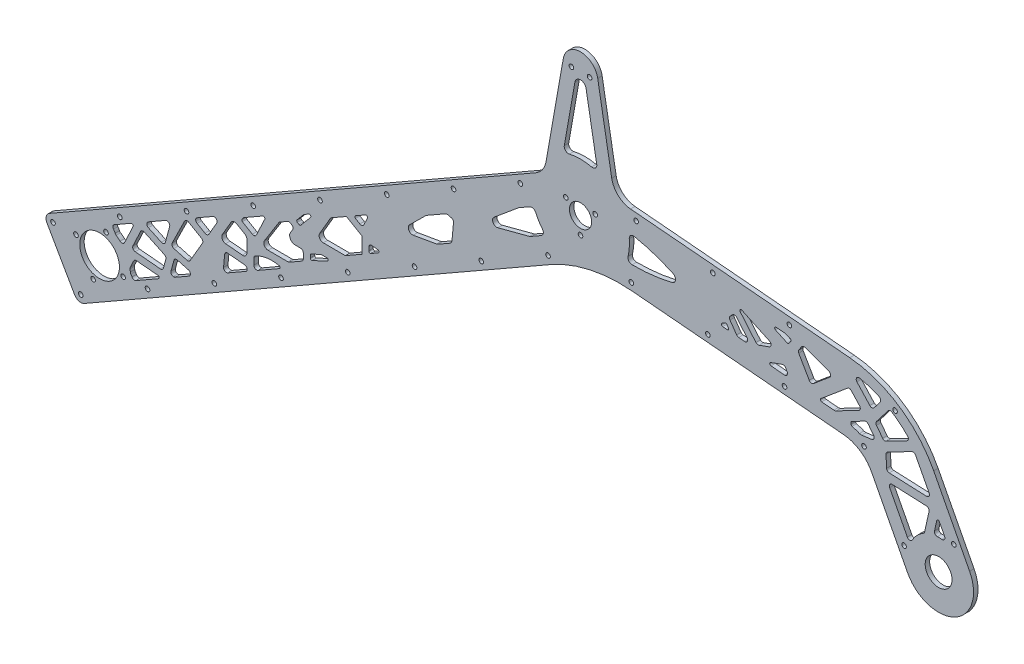
from build123d import *

# Parameters (mm, degrees)
SKETCH2_R              = 7.9375
SKETCH2_R_2            = 14.2
SKETCH2_R_3            = 1.65
SKETCH2_R_4            = 9.5885
BASE_DEPTH             = 3.175
SKETCH3_R              = 1.65
STRUT_HOLES_DEPTH      = 448.434897902
LIGHTENING_HOLES_DEPTH = 448.434897902
SKETCH7_R              = 1.65
CUT_EXTRUDE1_DEPTH     = 448.434897902


with BuildPart() as part:
    # Sketch2 → Base (new body)
    with BuildSketch(Plane.XY):
        with BuildLine():
            Line((-379.716809958, -188.506893436), (-32.006532147, 10.487277971))
            ThreePointArc((-32.006532147, 10.487277971), (-27.186230121, 14.879084252), (-24.685038782, 20.901319377))
            Line((-24.685038782, 20.901319377), (-12.310096913, 91.083102221))
            ThreePointArc((-12.310096913, 91.083102221), (0, 101.4125), (12.310096913, 91.083102221))
            Line((12.310096913, 91.083102221), (22.322003955, 34.302755831))
            ThreePointArc((22.322003955, 34.302755831), (26.960267136, 25.848318444), (35.786784109, 21.964558025))
            Line((35.786784109, 21.964558025), (192.586144941, 8.246391504))
            ThreePointArc((192.586144941, 8.246391504), (227.717231711, -4.10798993), (252.575276723, -31.83706486))
            Line((252.575276723, -31.83706486), (278.255270829, -81.167874559))
            ThreePointArc((278.255270829, -81.167874559), (267.623715331, -114.886860719), (233.904729171, -104.255305221))
            Line((233.904729171, -104.255305221), (208.224735064, -54.924495522))
            ThreePointArc((208.224735064, -54.924495522), (199.93872006, -45.681470545), (188.228357804, -41.563343401))
            Line((188.228357804, -41.563343401), (36.823729736, -28.317154839))
            ThreePointArc((36.823729736, -28.317154839), (6.649577682, -30.266109959), (-21.562664076, -41.144864173))
            Line((-21.562664076, -41.144864173), (-354.881400189, -231.902773674))
            ThreePointArc((-354.881400189, -231.902773674), (-358.677364619, -232.387866435), (-361.70452919, -230.046726627))
            Line((-361.70452919, -230.046726627), (-381.572857005, -195.330022437))
            ThreePointArc((-381.572857005, -195.330022437), (-382.057949767, -191.534058007), (-379.716809958, -188.506893436))
        make_face()
        Circle(SKETCH2_R, mode=Mode.SUBTRACT)
        with Locations((-343.92, -196.825)):
            Circle(SKETCH2_R_2, mode=Mode.SUBTRACT)
        with Locations((-6.5, 88.9125)):
            Circle(SKETCH2_R_3, mode=Mode.SUBTRACT)
        with Locations((6.5, 88.9125)):
            Circle(SKETCH2_R_3, mode=Mode.SUBTRACT)
        with Locations((256.08, -92.71158989)):
            Circle(SKETCH2_R_4, mode=Mode.SUBTRACT)
        with Locations((-360.806382749, -192.231517914)):
            Circle(SKETCH2_R_3, mode=Mode.SUBTRACT)
        with Locations((-339.326517914, -179.938617251)):
            Circle(SKETCH2_R_3, mode=Mode.SUBTRACT)
        with Locations((-327.033617251, -201.418482086)):
            Circle(SKETCH2_R_3, mode=Mode.SUBTRACT)
        with Locations((-348.513482086, -213.711382749)):
            Circle(SKETCH2_R_3, mode=Mode.SUBTRACT)
    extrude(amount=BASE_DEPTH)

    # Sketch3 → Strut Holes (cut, through all)
    with BuildSketch(Plane.XY.offset(3.175)):
        with Locations((-357.364941166, -227.56318565)):
            Circle(SKETCH3_R)
        with Locations((-309.629472905, -200.244234904)):
            Circle(SKETCH3_R)
        with Locations((-261.894004643, -172.925284158)):
            Circle(SKETCH3_R)
        with Locations((-214.158536382, -145.606333412)):
            Circle(SKETCH3_R)
        with Locations((-166.42306812, -118.287382666)):
            Circle(SKETCH3_R)
        with Locations((-118.687599859, -90.96843192)):
            Circle(SKETCH3_R)
        with Locations((-329.49780072, -165.527530714)):
            Circle(SKETCH3_R)
        with Locations((-377.233268981, -192.84648146)):
            Circle(SKETCH3_R)
        with Locations((-281.762332458, -138.208579968)):
            Circle(SKETCH3_R)
        with Locations((-234.026864197, -110.889629222)):
            Circle(SKETCH3_R)
        with Locations((-186.291395936, -83.570678476)):
            Circle(SKETCH3_R)
        with Locations((-138.555927674, -56.25172773)):
            Circle(SKETCH3_R)
        with Locations((36.307361546, -23.252879289)):
            Circle(SKETCH3_R)
        with Locations((91.098069941, -28.04644514)):
            Circle(SKETCH3_R)
        with Locations((145.888778336, -32.840010991)):
            Circle(SKETCH3_R)
        with Locations((149.375008046, 7.007776933)):
            Circle(SKETCH3_R)
        with Locations((94.584299651, 11.801342784)):
            Circle(SKETCH3_R)
        with Locations((39.793591256, 16.594908635)):
            Circle(SKETCH3_R)
        with Locations((-70.952131597, -63.649481174)):
            Circle(SKETCH3_R)
        with Locations((-23.216663336, -36.330530428)):
            Circle(SKETCH3_R)
        with Locations((-43.084991151, -1.613826238)):
            Circle(SKETCH3_R)
        with Locations((-90.820459413, -28.932776984)):
            Circle(SKETCH3_R)
        with Locations((202.716571226, -41.524122484)):
            Circle(SKETCH3_R)
        with Locations((224.939380546, -8.265337992)):
            Circle(SKETCH3_R)
        with Locations((231.413554138, -88.641399657)):
            Circle(SKETCH3_R)
        with Locations((266.893987465, -70.171455127)):
            Circle(SKETCH3_R)
    extrude(amount=-STRUT_HOLES_DEPTH, mode=Mode.SUBTRACT)

    # Sketch6 → Lightening Holes (cut, through all)
    with BuildSketch(Plane.XY.offset(3.175)):
        with BuildLine():
            Line((-317.937082153, -199.237754107), (-301.759255291, -189.979203363))
            ThreePointArc((-301.759255291, -189.979203363), (-301.27885272, -188.89855459), (-302.165025934, -188.115429161))
            Line((-302.165025934, -188.115429161), (-317.529091672, -186.71244549))
            ThreePointArc((-317.529091672, -186.71244549), (-318.704383169, -186.968323474), (-319.520360019, -187.852045956))
            Line((-319.520360019, -187.852045956), (-321.920665487, -192.94890269))
            ThreePointArc((-321.920665487, -192.94890269), (-322.086706026, -193.488507205), (-322.095332893, -194.053014132))
            ThreePointArc((-322.095332893, -194.053014132), (-321.995430567, -195.004765075), (-321.937013257, -195.959960211))
            ThreePointArc((-321.937013257, -195.959960211), (-321.816611469, -196.56901374), (-321.515239324, -197.111800643))
            ThreePointArc((-321.515239324, -197.111800643), (-321.089709213, -197.721191561), (-320.73119159, -198.372266273))
            ThreePointArc((-320.73119159, -198.372266273), (-319.522268091, -199.412366176), (-317.937082153, -199.237754107))
        make_face()
        with BuildLine():
            Line((-289.844978396, -183.160677107), (-279.93882887, -177.491399715))
            ThreePointArc((-279.93882887, -177.491399715), (-278.948378644, -175.502042811), (-280.407275879, -173.825692191))
            Line((-280.407275879, -173.825692191), (-288.292322007, -171.680779414))
            ThreePointArc((-288.292322007, -171.680779414), (-289.810707779, -171.874816518), (-290.747163702, -173.085682346))
            Line((-290.747163702, -173.085682346), (-292.868560549, -180.884280112))
            ThreePointArc((-292.868560549, -180.884280112), (-292.613471256, -182.502456625), (-291.234784363, -183.387209827))
            ThreePointArc((-291.234784363, -183.387209827), (-291.195764259, -183.393163574), (-291.156778347, -183.399337252))
            ThreePointArc((-291.156778347, -183.399337252), (-290.480404568, -183.392541824), (-289.844978396, -183.160677107))
        make_face()
        with BuildLine():
            Line((-225.068253149, -146.0890356), (-215.394271166, -140.552627413))
            ThreePointArc((-215.394271166, -140.552627413), (-214.903636001, -139.526112554), (-215.691072999, -138.704894803))
            ThreePointArc((-215.691072999, -138.704894803), (-224.321295756, -138.46558821), (-232.518295989, -141.176160044))
            ThreePointArc((-232.518295989, -141.176160044), (-233.286477009, -141.90836482), (-233.571916458, -142.930495063))
            Line((-233.571916458, -142.930495063), (-233.587977081, -147.160409637))
            Line((-233.587977081, -147.160409637), (-233.589300921, -147.509071621))
            ThreePointArc((-233.589300921, -147.509071621), (-232.59588453, -149.244906831), (-230.595898947, -149.252500605))
            Line((-230.595898947, -149.252500605), (-225.068253149, -146.0890356))
        make_face()
        with BuildLine():
            Line((-202.450189496, -105.529322903), (-201.311100417, -106.192755657))
            ThreePointArc((-201.311100417, -106.192755657), (-200.637908098, -106.314094916), (-200.044217491, -105.974326499))
            Line((-200.044217491, -105.974326499), (-193.10874934, -97.772404377))
            ThreePointArc((-193.10874934, -97.772404377), (-193.103868157, -96.486838424), (-194.369055865, -96.258795212))
            Line((-194.369055865, -96.258795212), (-197.510306407, -98.056529098))
            ThreePointArc((-197.510306407, -98.056529098), (-197.796638801, -98.255405281), (-198.044086675, -98.500981186))
            Line((-198.044086675, -98.500981186), (-202.710503229, -104.019510625))
            ThreePointArc((-202.710503229, -104.019510625), (-202.932364876, -104.835109908), (-202.450189496, -105.529322903))
        make_face()
        with BuildLine():
            Line((-333.444620565, -172.395023354), (-321.324736547, -165.45882839))
            ThreePointArc((-321.324736547, -165.45882839), (-320.149643655, -165.592039112), (-319.923331731, -166.752802359))
            Line((-319.923331731, -166.752802359), (-326.076688787, -179.818964042))
            ThreePointArc((-326.076688787, -179.818964042), (-327.489682534, -180.927174615), (-329.222241859, -180.455030372))
            ThreePointArc((-329.222241859, -180.455030372), (-330.587096563, -179.325466122), (-332.03841525, -178.309386485))
            ThreePointArc((-332.03841525, -178.309386485), (-332.502552417, -177.897052298), (-332.817881567, -177.362252973))
            ThreePointArc((-332.817881567, -177.362252973), (-333.319567754, -176.344657072), (-333.979051672, -175.421471605))
            ThreePointArc((-333.979051672, -175.421471605), (-334.420732076, -173.783065742), (-333.444620565, -172.395023354))
        make_face()
        with BuildLine():
            Line((-296.526078791, -175.281178461), (-298.296173769, -181.788333758))
            ThreePointArc((-298.296173769, -181.788333758), (-299.085121934, -182.906012266), (-300.407921189, -183.255077571))
            Line((-300.407921189, -183.255077571), (-318.426512518, -181.609693475))
            ThreePointArc((-318.426512518, -181.609693475), (-319.980472622, -180.611396672), (-320.054030653, -178.765867554))
            Line((-320.054030653, -178.765867554), (-314.587930437, -167.159040818))
            ThreePointArc((-314.587930437, -167.159040818), (-313.455436739, -166.129184627), (-311.926424469, -166.201760304))
            Line((-311.926424469, -166.201760304), (-297.603838378, -172.946815839))
            ThreePointArc((-297.603838378, -172.946815839), (-296.64013933, -173.917860945), (-296.526078791, -175.281178461))
        make_face()
        with BuildLine():
            Line((-296.725202345, -151.380544722), (-309.162121937, -158.49817876))
            ThreePointArc((-309.162121937, -158.49817876), (-310.167118822, -160.31366557), (-309.020818273, -162.043407211))
            Line((-309.020818273, -162.043407211), (-299.712508239, -166.427047688))
            ThreePointArc((-299.712508239, -166.427047688), (-298.022047377, -166.433466223), (-296.930523197, -165.142623828))
            Line((-296.930523197, -165.142623828), (-293.80191364, -153.641349312))
            ThreePointArc((-293.80191364, -153.641349312), (-294.508247327, -151.534307484), (-296.725202345, -151.380544722))
        make_face()
        with BuildLine():
            Line((-290.749203903, -165.830761417), (-281.418682259, -168.368876575))
            ThreePointArc((-281.418682259, -168.368876575), (-280.135367262, -168.289656018), (-279.165471442, -167.445573454))
            Line((-279.165471442, -167.445573454), (-270.334962051, -152.283921043))
            ThreePointArc((-270.334962051, -152.283921043), (-270.129400346, -150.767052513), (-271.056634293, -149.549110414))
            Line((-271.056634293, -149.549110414), (-280.339031078, -144.142820271))
            ThreePointArc((-280.339031078, -144.142820271), (-281.923077504, -143.956245777), (-283.139846515, -144.987500494))
            Line((-283.139846515, -144.987500494), (-292.018480766, -163.01732789))
            ThreePointArc((-292.018480766, -163.01732789), (-292.047293032, -164.72335957), (-290.749203903, -165.830761417))
        make_face()
        with BuildLine():
            Line((-274.174863713, -138.475013199), (-262.829621171, -131.982144615))
            ThreePointArc((-262.829621171, -131.982144615), (-260.416631803, -132.309146065), (-260.107963345, -134.724549018))
            Line((-260.107963345, -134.724549018), (-265.805400683, -144.506834582))
            ThreePointArc((-265.805400683, -144.506834582), (-267.023342782, -145.43406853), (-268.540211311, -145.228506825))
            Line((-268.540211311, -145.228506825), (-274.188016515, -141.939089844))
            ThreePointArc((-274.188016515, -141.939089844), (-275.181432906, -140.203254635), (-274.174863713, -138.475013199))
        make_face()
        with BuildLine():
            Line((-255.261313261, -159.742391016), (-254.488576255, -151.280152708))
            ThreePointArc((-254.488576255, -151.280152708), (-253.776611846, -149.925068788), (-252.314987955, -149.470314621))
            Line((-252.314987955, -149.470314621), (-240.229659184, -150.573897437))
            ThreePointArc((-240.229659184, -150.573897437), (-238.457312757, -152.140148294), (-239.418117899, -154.30144584))
            Line((-239.418117899, -154.30144584), (-252.276183677, -161.660101332))
            ThreePointArc((-252.276183677, -161.660101332), (-254.350596062, -161.606956723), (-255.261313261, -159.742391016))
        make_face()
        with BuildLine():
            Line((-249.949142761, -129.20392042), (-256.129617611, -139.815563221))
            ThreePointArc((-256.129617611, -139.815563221), (-256.203528398, -142.700549226), (-253.810068117, -144.312986801))
            Line((-253.810068117, -144.312986801), (-241.842841701, -145.405784992))
            ThreePointArc((-241.842841701, -145.405784992), (-239.551671104, -144.637726688), (-238.570050666, -142.429605863))
            Line((-238.570050666, -142.429605863), (-238.538476633, -134.113897012))
            ThreePointArc((-238.538476633, -134.113897012), (-238.934702194, -132.612381765), (-240.028601219, -131.510144198))
            Line((-240.028601219, -131.510144198), (-245.846926818, -128.121412056))
            ThreePointArc((-245.846926818, -128.121412056), (-248.122229612, -127.813069499), (-249.949142761, -129.20392042))
        make_face()
        with BuildLine():
            Line((-241.753564235, -124.719255848), (-234.63976684, -128.862501783))
            ThreePointArc((-234.63976684, -128.862501783), (-233.039032694, -129.043963991), (-231.823804406, -127.986373074))
            Line((-231.823804406, -127.986373074), (-225.796901327, -115.1887263))
            ThreePointArc((-225.796901327, -115.1887263), (-226.023213251, -114.027963054), (-227.198306143, -113.894752332))
            Line((-227.198306143, -113.894752332), (-240.486863137, -121.499777426))
            ThreePointArc((-240.486863137, -121.499777426), (-240.868014227, -121.782834524), (-241.171709307, -122.147754751))
            ThreePointArc((-241.171709307, -122.147754751), (-241.549582312, -122.675396768), (-241.974698217, -123.165774758))
            ThreePointArc((-241.974698217, -123.165774758), (-242.240299662, -123.996061899), (-241.753564235, -124.719255848))
        make_face()
        with BuildLine():
            Line((-215.700125094, -112.192821254), (-226.032975591, -128.589971196))
            ThreePointArc((-226.032975591, -128.589971196), (-226.124248281, -131.633833238), (-223.506276432, -133.189355733))
            Line((-223.506276432, -133.189355733), (-209.202252691, -133.243666885))
            ThreePointArc((-209.202252691, -133.243666885), (-208.68435958, -133.177484442), (-208.201242526, -132.979516511))
            Line((-208.201242526, -132.979516511), (-199.253531837, -127.858752507))
            ThreePointArc((-199.253531837, -127.858752507), (-198.518706793, -127.12948649), (-198.246962645, -126.130511071))
            Line((-198.246962645, -126.130511071), (-198.232362286, -122.28518887))
            ThreePointArc((-198.232362286, -122.28518887), (-198.812774892, -120.868761336), (-200.224754096, -120.277609512))
            Line((-200.224754096, -120.277609512), (-204.008629507, -120.263242462))
            ThreePointArc((-204.008629507, -120.263242462), (-207.499258639, -118.189212469), (-207.377561718, -114.130729746))
            Line((-207.377561718, -114.130729746), (-205.861080411, -111.724232972))
            ThreePointArc((-205.861080411, -111.724232972), (-205.610725726, -110.181490101), (-206.546571097, -108.929720762))
            Line((-206.546571097, -108.929720762), (-207.493132435, -108.378420775))
            ThreePointArc((-207.493132435, -108.378420775), (-208.492107854, -108.106676627), (-209.493118019, -108.370827001))
            Line((-209.493118019, -108.370827001), (-215.001481605, -111.523256819))
            ThreePointArc((-215.001481605, -111.523256819), (-215.391909437, -111.815147719), (-215.700125094, -112.192821254))
        make_face()
        with BuildLine():
            Line((-193.227653511, -121.054522852), (-193.234462366, -122.84778292))
            ThreePointArc((-193.234462366, -122.84778292), (-192.774967571, -123.692925108), (-191.815295507, -123.759485695))
            Line((-191.815295507, -123.759485695), (-180.993415111, -118.763096002))
            ThreePointArc((-180.993415111, -118.763096002), (-180.435478412, -117.642458946), (-181.408792291, -116.855197322))
            Line((-181.408792291, -116.855197322), (-185.032757855, -116.841437436))
            ThreePointArc((-185.032757855, -116.841437436), (-185.465813965, -116.887201486), (-185.878699763, -117.025611243))
            Line((-185.878699763, -117.025611243), (-192.646834787, -120.150413851))
            ThreePointArc((-192.646834787, -120.150413851), (-193.06900602, -120.517821741), (-193.227653511, -121.054522852))
        make_face()
        with BuildLine():
            Line((-168.149004332, -108.905485935), (-183.952737992, -108.845480513))
            ThreePointArc((-183.952737992, -108.845480513), (-186.545100145, -107.335626723), (-186.533709485, -104.335648348))
            Line((-186.533709485, -104.335648348), (-178.579876435, -90.679216235))
            Line((-178.579876435, -90.679216235), (-167.386832198, -84.273450557))
            Line((-167.386832198, -84.273450557), (-156.388373523, -90.679216235))
            Line((-156.388373523, -90.679216235), (-156.432116668, -102.199925297))
            Line((-156.432116668, -102.199925297), (-168.149004332, -108.905485935))
        make_face()
        with BuildLine():
            Line((-151.414615639, -97.600140871), (-151.405431829, -95.181384659))
            ThreePointArc((-151.405431829, -95.181384659), (-150.751018204, -93.709304109), (-149.223571139, -93.197265239))
            Line((-149.223571139, -93.197265239), (-145.032551994, -93.579971974))
            ThreePointArc((-145.032551994, -93.579971974), (-144.146378781, -94.363097402), (-144.626781352, -95.443746175))
            Line((-144.626781352, -95.443746175), (-149.917914652, -98.471855363))
            ThreePointArc((-149.917914652, -98.471855363), (-150.917907444, -98.468058476), (-151.414615639, -97.600140871))
        make_face()
        with BuildLine():
            Line((-160.872630183, -80.545380623), (-153.761861304, -76.475896195))
            ThreePointArc((-153.761861304, -76.475896195), (-152.586768412, -76.609106917), (-152.360456488, -77.769870163))
            Line((-152.360456488, -77.769870163), (-154.930028199, -83.226150228))
            ThreePointArc((-154.930028199, -83.226150228), (-156.145256487, -84.283741145), (-157.745990633, -84.102278936))
            Line((-157.745990633, -84.102278936), (-160.879206584, -82.277418946))
            ThreePointArc((-160.879206584, -82.277418946), (-161.375914779, -81.409501341), (-160.872630183, -80.545380623))
        make_face()
        with BuildLine():
            Line((-90.819864813, -49.698540482), (-91.896421351, -61.487904644))
            ThreePointArc((-91.896421351, -61.487904644), (-92.359955239, -62.836585977), (-93.393866555, -63.818844799))
            Line((-93.393866555, -63.818844799), (-101.994338017, -68.740884214))
            ThreePointArc((-101.994338017, -68.740884214), (-102.469113289, -68.960084777), (-102.974739436, -69.09351133))
            Line((-102.974739436, -69.09351133), (-119.629879497, -71.965101226))
            ThreePointArc((-119.629879497, -71.965101226), (-122.805875604, -70.383853511), (-122.252853304, -66.87936183))
            Line((-122.252853304, -66.87936183), (-110.681116507, -55.395166432))
            ThreePointArc((-110.681116507, -55.395166432), (-110.385100172, -55.137548838), (-110.057990454, -54.920773084))
            Line((-110.057990454, -54.920773084), (-96.724691463, -47.290142199))
            ThreePointArc((-96.724691463, -47.290142199), (-95.614849419, -46.918095089), (-94.447112805, -46.999086542))
            Line((-94.447112805, -46.999086542), (-92.286608626, -47.586793062))
            ThreePointArc((-92.286608626, -47.586793062), (-91.168930118, -48.375741228), (-90.819864813, -49.698540482))
        make_face()
        with BuildLine():
            Line((-28.096781534, -26.449402024), (-35.825401618, -30.87248195))
            ThreePointArc((-35.825401618, -30.87248195), (-36.178007781, -31.044706772), (-36.550077199, -31.169433846))
            Line((-36.550077199, -31.169433846), (-59.133973609, -37.128958431))
            ThreePointArc((-59.133973609, -37.128958431), (-62.565695554, -35.603385935), (-61.819045791, -31.92281518))
            Line((-61.819045791, -31.92281518), (-44.317223042, -17.349924163))
            ThreePointArc((-44.317223042, -17.349924163), (-44.108986088, -17.191390869), (-43.887724451, -17.051609889))
            Line((-43.887724451, -17.051609889), (-36.274597881, -12.694626761))
            ThreePointArc((-36.274597881, -12.694626761), (-33.845543285, -12.449097133), (-32.038330666, -14.090612767))
            ThreePointArc((-32.038330666, -14.090612767), (-29.904900702, -18.185073934), (-27.251097742, -21.963097956))
            ThreePointArc((-27.251097742, -21.963097956), (-26.638826778, -24.401372335), (-28.096781534, -26.449402024))
        make_face()
        with BuildLine():
            Line((-11.599665343, 37.524455033), (-3.986146646, 80.702865203))
            ThreePointArc((-3.986146646, 80.702865203), (0, 84.047639383), (3.986146646, 80.702865203))
            Line((3.986146646, 80.702865203), (11.599665343, 37.524455033))
            ThreePointArc((11.599665343, 37.524455033), (10.707449692, 34.824680589), (7.962722972, 34.082180723))
            ThreePointArc((7.962722972, 34.082180723), (0, 35), (-7.962722972, 34.082180723))
            ThreePointArc((-7.962722972, 34.082180723), (-10.707449692, 34.824680589), (-11.599665343, 37.524455033))
        make_face()
        with BuildLine():
            Line((246.075987756, -72.913561708), (249.254007124, -58.57844272))
            ThreePointArc((249.254007124, -58.57844272), (248.888121791, -56.928040634), (247.388653885, -56.147467049))
            Line((247.388653885, -56.147467049), (222.962162816, -55.080983417))
            ThreePointArc((222.962162816, -55.080983417), (221.188141149, -56.004480644), (221.100902375, -58.002577087))
            Line((221.100902375, -58.002577087), (233.735290203, -82.273010289))
            ThreePointArc((233.735290203, -82.273010289), (235.484637714, -83.349360854), (237.260008731, -82.316498325))
            ThreePointArc((237.260008731, -82.316498325), (240.657318696, -77.731906936), (245.140979083, -74.202461834))
            ThreePointArc((245.140979083, -74.202461834), (245.742284649, -73.655075389), (246.075987756, -72.913561708))
        make_face()
        with BuildLine():
            Line((253.133679234, -68.799730633), (254.751992566, -61.499990928))
            ThreePointArc((254.751992566, -61.499990928), (255.597762381, -60.72498568), (256.615299406, -61.254681929))
            Line((256.615299406, -61.254681929), (260.345615198, -68.420551892))
            ThreePointArc((260.345615198, -68.420551892), (260.223925452, -70.470902803), (258.359543018, -71.332775993))
            ThreePointArc((258.359543018, -71.332775993), (256.767087179, -71.222571503), (255.170843908, -71.230820928))
            ThreePointArc((255.170843908, -71.230820928), (253.553325039, -70.51716267), (253.133679234, -68.799730633))
        make_face()
        with BuildLine():
            Line((249.310771487, -47.22281435), (239.59747458, -28.563744597))
            ThreePointArc((239.59747458, -28.563744597), (238.424864512, -27.579807922), (236.899955687, -27.713220157))
            Line((236.899955687, -27.713220157), (219.565597936, -36.736915644))
            ThreePointArc((219.565597936, -36.736915644), (218.757044355, -37.510937311), (218.490998719, -38.598176086))
            Line((218.490998719, -38.598176086), (218.860832904, -47.068771554))
            ThreePointArc((218.860832904, -47.068771554), (219.444715785, -48.395746342), (220.771690573, -48.979629223))
            Line((220.771690573, -48.979629223), (247.449511046, -50.144408019))
            ThreePointArc((247.449511046, -50.144408019), (249.223532712, -49.220910793), (249.310771487, -47.22281435))
        make_face()
        with BuildLine():
            Line((233.413458883, -22.763883833), (218.618137266, -30.46584077))
            ThreePointArc((218.618137266, -30.46584077), (217.261760811, -30.644411118), (216.107933359, -29.909341962))
            Line((216.107933359, -29.909341962), (211.671799483, -24.128059737))
            ThreePointArc((211.671799483, -24.128059737), (211.258506163, -22.910536879), (211.671799483, -21.693014021))
            Line((211.671799483, -21.693014021), (220.007167815, -10.830150518))
            ThreePointArc((220.007167815, -10.830150518), (221.257760997, -10.076118732), (222.687548657, -10.3731953))
            ThreePointArc((222.687548657, -10.3731953), (228.553817552, -14.676513168), (233.918900039, -19.590528361))
            ThreePointArc((233.918900039, -19.590528361), (234.465065341, -21.304449895), (233.413458883, -22.763883833))
        make_face()
        with BuildLine():
            Line((209.61657846, -31.305721344), (205.746256457, -26.261819508))
            ThreePointArc((205.746256457, -26.261819508), (204.592429004, -25.526750352), (203.23605255, -25.7053207))
            Line((203.23605255, -25.7053207), (194.010059092, -30.508068903))
            ThreePointArc((194.010059092, -30.508068903), (193.616895834, -30.876306478), (193.471807705, -31.395079736))
            Line((193.471807705, -31.395079736), (193.471807705, -32.496691451))
            ThreePointArc((193.471807705, -32.496691451), (193.684204256, -33.112873898), (194.23116932, -33.467306291))
            ThreePointArc((194.23116932, -33.467306291), (196.89746606, -34.245224393), (199.491371204, -35.238175037))
            ThreePointArc((199.491371204, -35.238175037), (200.2654041, -35.454155852), (201.069000396, -35.456918226))
            Line((201.069000396, -35.456918226), (208.290924164, -34.506133925))
            ThreePointArc((208.290924164, -34.506133925), (209.877630844, -33.288611067), (209.61657846, -31.305721344))
        make_face()
        with BuildLine():
            Line((214.303083467, -8.407780179), (209.957683706, -14.070815403))
            ThreePointArc((209.957683706, -14.070815403), (208.4582158, -14.851388988), (206.896422352, -14.20447296))
            Line((206.896422352, -14.20447296), (197.688681904, -4.155987535))
            ThreePointArc((197.688681904, -4.155987535), (197.423723958, -1.817844179), (199.566737265, -0.845933158))
            ThreePointArc((199.566737265, -0.845933158), (206.676023639, -2.722269436), (213.536897173, -5.366320289))
            ThreePointArc((213.536897173, -5.366320289), (214.655785228, -6.701693203), (214.303083467, -8.407780179))
        make_face()
        with BuildLine():
            Line((193.681402215, -11.624307007), (199.545514004, -18.023862053))
            ThreePointArc((199.545514004, -18.023862053), (200.040574836, -19.722338824), (198.994456557, -21.149064135))
            Line((198.994456557, -21.149064135), (182.807531418, -29.575444012))
            ThreePointArc((182.807531418, -29.575444012), (182.007556544, -29.856767353), (181.16081835, -29.902995606))
            Line((181.16081835, -29.902995606), (172.48260155, -29.143750017))
            ThreePointArc((172.48260155, -29.143750017), (171.616040342, -28.448261118), (171.926969683, -27.381510875))
            Line((171.926969683, -27.381510875), (190.921272322, -11.443398536))
            ThreePointArc((190.921272322, -11.443398536), (192.3376538, -10.979769576), (193.681402215, -11.624307007))
        make_face()
        with BuildLine():
            Line((178.199205815, -11.022517891), (166.591800736, -20.762287211))
            ThreePointArc((166.591800736, -20.762287211), (164.958929162, -21.199813831), (163.574174709, -20.230198325))
            Line((163.574174709, -20.230198325), (156.047951006, -7.194396481))
            ThreePointArc((156.047951006, -7.194396481), (155.78190537, -6.107157706), (156.141697725, -5.047243608))
            Line((156.141697725, -5.047243608), (158.18845934, -2.124165087))
            ThreePointArc((158.18845934, -2.124165087), (159.22535183, -1.363884058), (160.510803716, -1.391932718))
            Line((160.510803716, -1.391932718), (177.597670882, -7.611043763))
            ThreePointArc((177.597670882, -7.611043763), (178.883246101, -9.143132649), (178.199205815, -11.022517891))
        make_face()
        with BuildLine():
            Line((146.644806866, -20.907673079), (147.746965574, -22.816667961))
            ThreePointArc((147.746965574, -22.816667961), (147.701697658, -24.891267177), (145.840603281, -25.809057357))
            Line((145.840603281, -25.809057357), (136.229987031, -24.968237386))
            ThreePointArc((136.229987031, -24.968237386), (135.325697913, -24.10256888), (135.975122631, -23.032350067))
            Line((135.975122631, -23.032350067), (144.228715771, -20.028287838))
            ThreePointArc((144.228715771, -20.028287838), (145.596796345, -20.028287838), (146.644806866, -20.907673079))
        make_face()
        with BuildLine():
            Line((134.974345297, -13.819003275), (127.671845659, -16.476895779))
            ThreePointArc((127.671845659, -16.476895779), (126.470167282, -16.52936219), (125.455716486, -15.883085757))
            Line((125.455716486, -15.883085757), (114.198527576, -2.46729043))
            ThreePointArc((114.198527576, -2.46729043), (114.171218678, -1.215741392), (115.387190281, -0.918195034))
            Line((115.387190281, -0.918195034), (135.135541534, -10.127002459))
            ThreePointArc((135.135541534, -10.127002459), (136.288401454, -12.026856808), (134.974345297, -13.819003275))
        make_face()
        with BuildLine():
            Line((139.430597275, -1.096040654), (147.83182135, -5.013595778))
            ThreePointArc((147.83182135, -5.013595778), (148.513258657, -5.073213817), (149.073591656, -4.680864427))
            Line((149.073591656, -4.680864427), (150.425898479, -2.749570135))
            ThreePointArc((150.425898479, -2.749570135), (150.560463385, -1.875287899), (149.948766578, -1.236301077))
            Line((149.948766578, -1.236301077), (146.098496258, 0.165082713))
            ThreePointArc((146.098496258, 0.165082713), (145.72175467, 0.274892872), (145.333903056, 0.334588945))
            Line((145.333903056, 0.334588945), (139.940371279, 0.806461832))
            ThreePointArc((139.940371279, 0.806461832), (138.88728971, 0.069086179), (139.430597275, -1.096040654))
        make_face()
        with BuildLine():
            Line((111.660494937, -7.221200049), (119.04545342, -16.022250853))
            ThreePointArc((119.04545342, -16.022250853), (119.2873862, -18.231323299), (117.339053048, -19.300215468))
            Line((117.339053048, -19.300215468), (113.116226003, -18.930765974))
            ThreePointArc((113.116226003, -18.930765974), (112.290537488, -18.670427385), (111.6522334, -18.08552945))
            Line((111.6522334, -18.08552945), (106.877510971, -11.266519132))
            ThreePointArc((106.877510971, -11.266519132), (106.523425664, -9.945054773), (107.101601497, -8.705152697))
            Line((107.101601497, -8.705152697), (108.714192488, -7.092561706))
            ThreePointArc((108.714192488, -7.092561706), (110.215644825, -6.508678825), (111.660494937, -7.221200049))
        make_face()
        with BuildLine():
            Line((104.703890017, -15.136053881), (105.75536165, -16.637710998))
            ThreePointArc((105.75536165, -16.637710998), (105.80223501, -17.711287434), (104.849053863, -18.207482132))
            Line((104.849053863, -18.207482132), (101.67727128, -17.929987113))
            ThreePointArc((101.67727128, -17.929987113), (100.788131016, -17.150232029), (101.264427023, -16.067767011))
            Line((101.264427023, -16.067767011), (103.384737973, -14.843604914))
            ThreePointArc((103.384737973, -14.843604914), (104.101177587, -14.73333431), (104.703890017, -15.136053881))
        make_face()
        with BuildLine():
            ThreePointArc((34.863622447, 3.086718303), (34.900341082, -2.63935454), (34.002891304, -8.294780463))
            ThreePointArc((34.002891304, -8.294780463), (34.552114447, -10.851108963), (36.89804352, -12.005699039))
            ThreePointArc((36.89804352, -12.005699039), (51.290024205, -11.233136631), (65.485577957, -8.740705208))
            ThreePointArc((65.485577957, -8.740705208), (67.910545504, -5.973310403), (66.09771963, -2.77134164))
            ThreePointArc((66.09771963, -2.77134164), (52.541526947, 2.603547383), (38.433463256, 6.29439159))
            ThreePointArc((38.433463256, 6.29439159), (35.846829531, 5.582787002), (34.863622447, 3.086718303))
        make_face()
    extrude(amount=-LIGHTENING_HOLES_DEPTH, mode=Mode.SUBTRACT)

    # Sketch7 → Cut-Extrude1 (cut, through all)
    with BuildSketch(Plane.XY.offset(3.175)):
        with Locations((-10.5, 6.062177826)):
            Circle(SKETCH7_R)
        with Locations((10.5, 6.062177826)):
            Circle(SKETCH7_R)
        with Locations((0, -12.124355653)):
            Circle(SKETCH7_R)
    extrude(amount=-CUT_EXTRUDE1_DEPTH, mode=Mode.SUBTRACT)


solid = part.part
